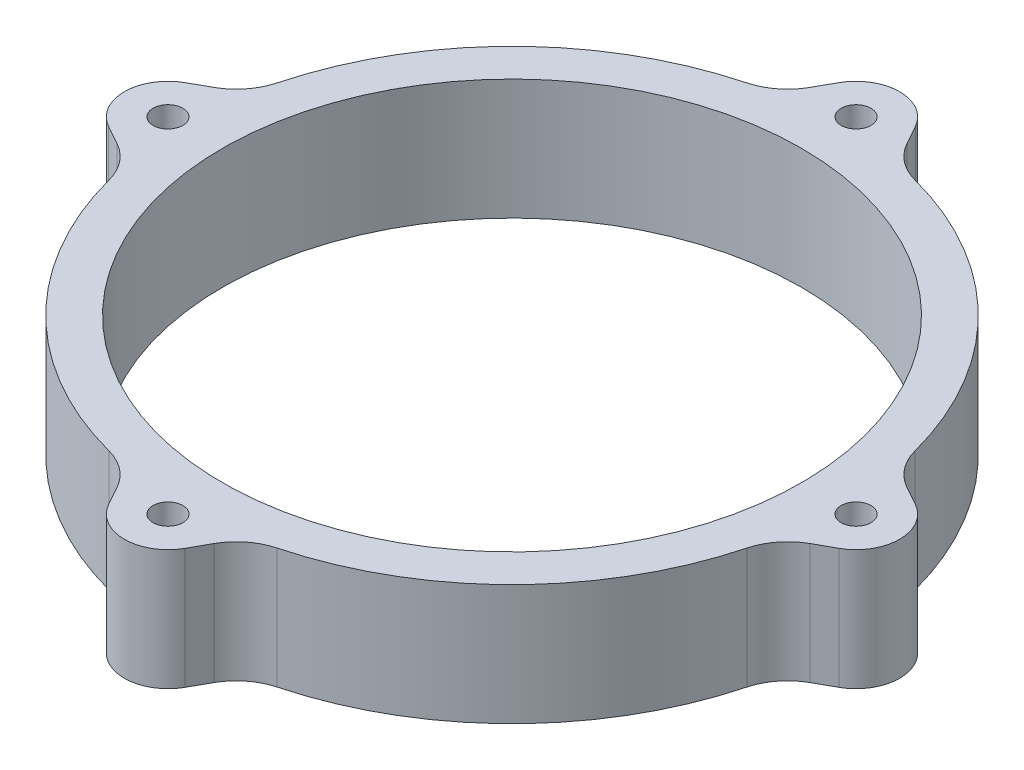
from build123d import *

# Parameters (mm, degrees)
SKETCH_1_R      = 50.5
SKETCH_1_R_2    = 2.6
EXTRUDE_1_DEPTH = 21
FILLET_1_R      = 10


with BuildPart() as part:
    # ｽｹｯﾁ1 → ﾎﾞｽ - 押し出し1 (new body)
    with BuildSketch(Plane(origin=(0, 0, 0), x_dir=(1, 0, 0), z_dir=(0, 1, 0))):
        with BuildLine():
            Line((-6.641105235, 63.695364835), (-10.641105235, 56.506786136))
            ThreePointArc((-10.641105235, 56.506786136), (-40.658639918, 40.658639918), (-56.506786136, 10.641105235))
            Line((-56.506786136, 10.641105235), (-63.695364835, 6.641105235))
            ThreePointArc((-63.695364835, 6.641105235), (-67.6, 0), (-63.695364835, -6.641105235))
            Line((-63.695364835, -6.641105235), (-56.506786136, -10.641105235))
            ThreePointArc((-56.506786136, -10.641105235), (-40.658639918, -40.658639918), (-10.641105235, -56.506786136))
            Line((-10.641105235, -56.506786136), (-6.641105235, -63.695364835))
            ThreePointArc((-6.641105235, -63.695364835), (0, -67.6), (6.641105235, -63.695364835))
            Line((6.641105235, -63.695364835), (10.641105235, -56.506786136))
            ThreePointArc((10.641105235, -56.506786136), (40.658639918, -40.658639918), (56.506786136, -10.641105235))
            Line((56.506786136, -10.641105235), (63.695364835, -6.641105235))
            ThreePointArc((63.695364835, -6.641105235), (67.6, 0), (63.695364835, 6.641105235))
            Line((63.695364835, 6.641105235), (56.506786136, 10.641105235))
            ThreePointArc((56.506786136, 10.641105235), (40.658639918, 40.658639918), (10.641105235, 56.506786136))
            Line((10.641105235, 56.506786136), (6.641105235, 63.695364835))
            ThreePointArc((6.641105235, 63.695364835), (0, 67.6), (-6.641105235, 63.695364835))
        make_face()
        Circle(SKETCH_1_R, mode=Mode.SUBTRACT)
        with Locations((0, 60)):
            Circle(SKETCH_1_R_2, mode=Mode.SUBTRACT)
        with Locations((60, 0)):
            Circle(SKETCH_1_R_2, mode=Mode.SUBTRACT)
        with Locations((0, -60)):
            Circle(SKETCH_1_R_2, mode=Mode.SUBTRACT)
        with Locations((-60, 0)):
            Circle(SKETCH_1_R_2, mode=Mode.SUBTRACT)
    extrude(amount=EXTRUDE_1_DEPTH)

    # ﾌｨﾚｯﾄ1
    fillet_1_edges = [part.edges().sort_by_distance(p)[0] for p in [
        (56.506786136, 10.5, 10.641105235),
        (56.506786136, 10.5, -10.641105235),
        (10.641105235, 10.5, -56.506786136),
        (-10.641105235, 10.5, -56.506786136),
        (-56.506786136, 10.5, -10.641105235),
        (-56.506786136, 10.5, 10.641105235),
        (-10.641105235, 10.5, 56.506786136),
        (10.641105235, 10.5, 56.506786136),
    ]]
    fillet(fillet_1_edges, radius=FILLET_1_R)


solid = part.part
